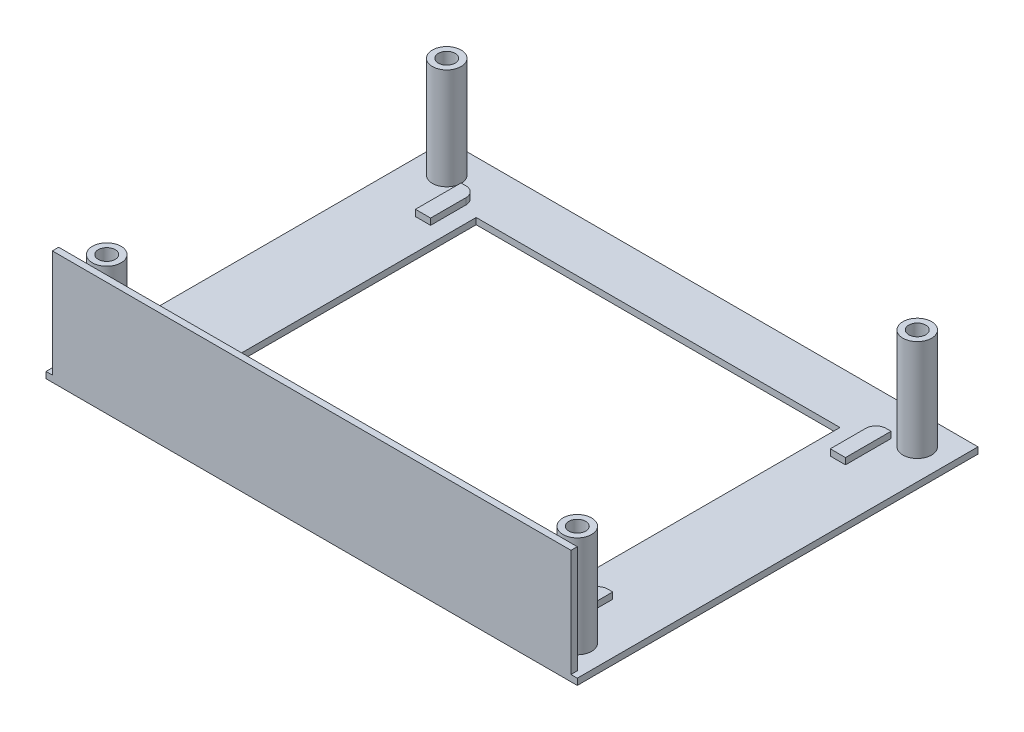
from build123d import *

# Parameters (mm, degrees)
SKETCH1_W           = 133.30125
SKETCH1_H           = 100.54249573
BOSS_EXTRUDE1_DEPTH = 1.5875
SKETCH1_3_R         = 3.6
SKETCH1_3_R_2       = 2.125
BOSS_EXTRUDE2_DEPTH = 25.4
BOSS_EXTRUDE4_DEPTH = 1.5875
SKETCH1_7_W         = 91.28125
SKETCH1_7_H         = 68.2625
CUT_EXTRUDE1_DEPTH  = 4.1275
SKETCH1_9_W         = 130.12625
SKETCH1_9_H         = 1.5875
BOSS_EXTRUDE5_DEPTH = 26.9875


with BuildPart() as part:
    # Sketch1 → Boss-Extrude1 (new body)
    with BuildSketch(Plane(origin=(0, 0, 0), x_dir=(1, 0, 0), z_dir=(0, 1, 0))):
        with Locations((0.5, -3.020002135)):
            Rectangle(SKETCH1_W, SKETCH1_H)
    extrude(amount=-BOSS_EXTRUDE1_DEPTH)

    # Sketch1<3> → Boss-Extrude2 (add)
    # profile 1 of 4: a face of its own
    with BuildSketch(Plane(origin=(0, 0, 0), x_dir=(1, 0, 0), z_dir=(0, 1, 0))):
        with Locations((59.530625, 39.63124573)):
            Circle(SKETCH1_3_R)
        with Locations((59.530625, 39.63124573)):
            Circle(SKETCH1_3_R_2, mode=Mode.SUBTRACT)
    # profile 2 of 4: a face of its own
    with BuildSketch(Plane(origin=(0, 0, 0), x_dir=(1, 0, 0), z_dir=(0, 1, 0))):
        with Locations((-58.530625, 39.63124573)):
            Circle(SKETCH1_3_R)
        with Locations((-58.530625, 39.63124573)):
            Circle(SKETCH1_3_R_2, mode=Mode.SUBTRACT)
    # profile 3 of 4: a face of its own
    with BuildSketch(Plane(origin=(0, 0, 0), x_dir=(1, 0, 0), z_dir=(0, 1, 0))):
        with Locations((59.530625, -45.67125)):
            Circle(SKETCH1_3_R)
        with Locations((59.530625, -45.67125)):
            Circle(SKETCH1_3_R_2, mode=Mode.SUBTRACT)
    # profile 4 of 4: a face of its own
    with BuildSketch(Plane(origin=(0, 0, 0), x_dir=(1, 0, 0), z_dir=(0, 1, 0))):
        with Locations((-58.530625, -45.67125)):
            Circle(SKETCH1_3_R)
        with Locations((-58.530625, -45.67125)):
            Circle(SKETCH1_3_R_2, mode=Mode.SUBTRACT)
    extrude(amount=BOSS_EXTRUDE2_DEPTH)

    # Sketch1<6> → Boss-Extrude4 (add)
    with BuildSketch(Plane(origin=(0, 0, 0), x_dir=(1, 0, 0), z_dir=(0, 1, 0))):
        with BuildLine():
            ThreePointArc((53.180625, 38.13125), (51.384573776, 37.387301224), (50.640625, 35.59125))
            Line((50.640625, 35.59125), (50.640625, 26.70125))
            Line((50.640625, 26.70125), (54.450625, 26.70125))
            Line((54.450625, 26.70125), (54.450625, 38.13125))
            Line((54.450625, 38.13125), (53.180625, 38.13125))
        make_face()
        with BuildLine():
            Line((50.640625, -43.13125), (39.210625, -43.13125))
            Line((39.210625, -43.13125), (39.210625, -46.94125))
            Line((39.210625, -46.94125), (54.450625, -46.94125))
            Line((54.450625, -46.94125), (54.450625, -31.70125))
            Line((54.450625, -31.70125), (53.180625, -31.70125))
            ThreePointArc((53.180625, -31.70125), (51.384573776, -32.445198776), (50.640625, -34.24125))
            Line((50.640625, -34.24125), (50.640625, -43.13125))
        make_face()
        with BuildLine():
            Line((-49.640625, -43.13125), (-49.640625, -34.24125))
            ThreePointArc((-49.640625, -34.24125), (-50.384573776, -32.445198776), (-52.180625, -31.70125))
            Line((-52.180625, -31.70125), (-53.450625, -31.70125))
            Line((-53.450625, -31.70125), (-53.450625, -46.94125))
            Line((-53.450625, -46.94125), (-36.940625, -46.94125))
            Line((-36.940625, -46.94125), (-36.940625, -43.13125))
            Line((-36.940625, -43.13125), (-49.640625, -43.13125))
        make_face()
        with BuildLine():
            Line((-49.640625, 26.70125), (-49.640625, 35.59125))
            ThreePointArc((-49.640625, 35.59125), (-50.384573776, 37.387301224), (-52.180625, 38.13125))
            Line((-52.180625, 38.13125), (-53.450625, 38.13125))
            Line((-53.450625, 38.13125), (-53.450625, 26.70125))
            Line((-53.450625, 26.70125), (-49.640625, 26.70125))
        make_face()
    extrude(amount=BOSS_EXTRUDE4_DEPTH)

    # Sketch1<7> → Cut-Extrude1 (cut)
    with BuildSketch(Plane(origin=(0, 0, 0), x_dir=(1, 0, 0), z_dir=(0, 1, 0))):
        Rectangle(SKETCH1_7_W, SKETCH1_7_H)
    extrude(amount=-CUT_EXTRUDE1_DEPTH, mode=Mode.SUBTRACT)

    # Sketch1<9> → Boss-Extrude5 (add)
    with BuildSketch(Plane(origin=(0, 0, 0), x_dir=(1, 0, 0), z_dir=(0, 1, 0))):
        with Locations((0.5, -52.4975)):
            Rectangle(SKETCH1_9_W, SKETCH1_9_H)
    extrude(amount=BOSS_EXTRUDE5_DEPTH)


solid = part.part
